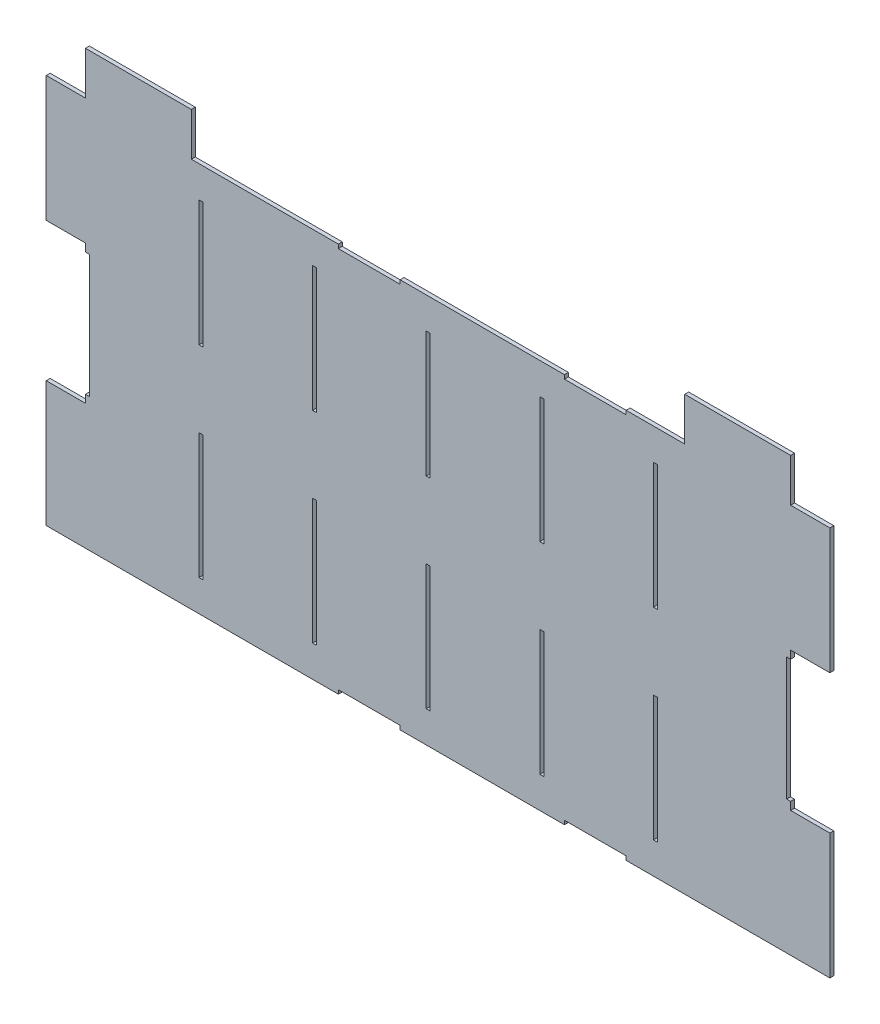
from build123d import *

# Parameters (mm, degrees)
SKETCH1_W                 = 570.860988324
SKETCH1_H                 = 315.575
BOSS_EXTRUDE1_DEPTH       = 3.175
SKETCH2_W                 = 3.175
SKETCH2_H                 = 101.6
CUT_EXTRUDE1_DEPTH        = 3.175
SKETCH7_W                 = 50
SKETCH7_H                 = 3.175
CUT_EXTRUDE5_DEPTH        = 3.175
LPATTERN2_COPY_1_SKETCH_W = 3.175
LPATTERN2_COPY_1_SKETCH_H = 101.6
LPATTERN2_COPY_1_DEPTH    = 3.175
LPATTERN2_COPY_2_SKETCH_W = 3.175
LPATTERN2_COPY_2_SKETCH_H = 101.6
LPATTERN2_COPY_2_DEPTH    = 3.175
LPATTERN2_COPY_3_SKETCH_W = 3.175
LPATTERN2_COPY_3_SKETCH_H = 101.6
LPATTERN2_COPY_3_DEPTH    = 3.175
LPATTERN2_COPY_4_SKETCH_W = 3.175
LPATTERN2_COPY_4_SKETCH_H = 101.6
LPATTERN2_COPY_4_DEPTH    = 3.175
LPATTERN2_COPY_5_SKETCH_W = 3.175
LPATTERN2_COPY_5_SKETCH_H = 101.6
LPATTERN2_COPY_5_DEPTH    = 3.175
LPATTERN2_COPY_6_SKETCH_W = 3.175
LPATTERN2_COPY_6_SKETCH_H = 101.6
LPATTERN2_COPY_6_DEPTH    = 3.175
LPATTERN2_COPY_7_SKETCH_W = 3.175
LPATTERN2_COPY_7_SKETCH_H = 101.6
LPATTERN2_COPY_7_DEPTH    = 3.175
LPATTERN2_COPY_8_SKETCH_W = 3.175
LPATTERN2_COPY_8_SKETCH_H = 101.6
LPATTERN2_COPY_8_DEPTH    = 3.175
SKETCH9_W                 = 85.725
SKETCH9_H                 = 34.925
SKETCH9_W_2               = 31.75
SKETCH9_H_2               = 101.6
BOSS_EXTRUDE3_DEPTH       = 3.175
SKETCH10_W                = 3.175
SKETCH10_H                = 99.675
CUT_EXTRUDE6_DEPTH        = 372.149099633


with BuildPart() as part:
    # Sketch1 → Boss-Extrude1 (new body)
    with BuildSketch(Plane.XY):
        Rectangle(SKETCH1_W, SKETCH1_H)
    extrude(amount=BOSS_EXTRUDE1_DEPTH)

    # Sketch2 → Cut-Extrude1 (cut)
    with BuildSketch(Plane.XY.offset(3.175)):
        with Locations((-191.887994162, -81.5875)):
            Rectangle(SKETCH2_W, SKETCH2_H)
    cut_extrude1 = extrude(amount=-CUT_EXTRUDE1_DEPTH, mode=Mode.SUBTRACT)

    # Sketch7 → Cut-Extrude5 (cut)
    with BuildSketch(Plane.XY.offset(3.175)):
        with Locations((127.304934912, -156.2)):
            Rectangle(SKETCH7_W, SKETCH7_H)
        with Locations((-55.695065088, -156.2)):
            Rectangle(SKETCH7_W, SKETCH7_H)
    cut_extrude5 = extrude(amount=-CUT_EXTRUDE5_DEPTH, mode=Mode.SUBTRACT)

    # Mirror3: Cut-Extrude1 across plane
    add(cut_extrude1.mirror(Plane.ZX), mode=Mode.SUBTRACT)

    # LPattern2 copy 1 sketch → LPattern2 copy 1 (cut)
    with BuildSketch(Plane(origin=(91.96, 0, 3.175), x_dir=(1, 0, 0), z_dir=(0, 0, 1))):
        with Locations((-191.887994162, 81.5875)):
            Rectangle(LPATTERN2_COPY_1_SKETCH_W, LPATTERN2_COPY_1_SKETCH_H)
    extrude(amount=-LPATTERN2_COPY_1_DEPTH, mode=Mode.SUBTRACT)

    # LPattern2 copy 2 sketch → LPattern2 copy 2 (cut)
    with BuildSketch(Plane(origin=(183.92, 0, 3.175), x_dir=(1, 0, 0), z_dir=(0, 0, 1))):
        with Locations((-191.887994162, 81.5875)):
            Rectangle(LPATTERN2_COPY_2_SKETCH_W, LPATTERN2_COPY_2_SKETCH_H)
    extrude(amount=-LPATTERN2_COPY_2_DEPTH, mode=Mode.SUBTRACT)

    # LPattern2 copy 3 sketch → LPattern2 copy 3 (cut)
    with BuildSketch(Plane(origin=(275.88, 0, 3.175), x_dir=(1, 0, 0), z_dir=(0, 0, 1))):
        with Locations((-191.887994162, 81.5875)):
            Rectangle(LPATTERN2_COPY_3_SKETCH_W, LPATTERN2_COPY_3_SKETCH_H)
    extrude(amount=-LPATTERN2_COPY_3_DEPTH, mode=Mode.SUBTRACT)

    # LPattern2 copy 4 sketch → LPattern2 copy 4 (cut)
    with BuildSketch(Plane(origin=(367.84, 0, 3.175), x_dir=(1, 0, 0), z_dir=(0, 0, 1))):
        with Locations((-191.887994162, 81.5875)):
            Rectangle(LPATTERN2_COPY_4_SKETCH_W, LPATTERN2_COPY_4_SKETCH_H)
    extrude(amount=-LPATTERN2_COPY_4_DEPTH, mode=Mode.SUBTRACT)

    # LPattern2 copy 5 sketch → LPattern2 copy 5 (cut)
    with BuildSketch(Plane(origin=(91.96, 0, 3.175), x_dir=(1, 0, 0), z_dir=(0, 0, 1))):
        with Locations((-191.887994162, -81.5875)):
            Rectangle(LPATTERN2_COPY_5_SKETCH_W, LPATTERN2_COPY_5_SKETCH_H)
    extrude(amount=-LPATTERN2_COPY_5_DEPTH, mode=Mode.SUBTRACT)

    # LPattern2 copy 6 sketch → LPattern2 copy 6 (cut)
    with BuildSketch(Plane(origin=(183.92, 0, 3.175), x_dir=(1, 0, 0), z_dir=(0, 0, 1))):
        with Locations((-191.887994162, -81.5875)):
            Rectangle(LPATTERN2_COPY_6_SKETCH_W, LPATTERN2_COPY_6_SKETCH_H)
    extrude(amount=-LPATTERN2_COPY_6_DEPTH, mode=Mode.SUBTRACT)

    # LPattern2 copy 7 sketch → LPattern2 copy 7 (cut)
    with BuildSketch(Plane(origin=(275.88, 0, 3.175), x_dir=(1, 0, 0), z_dir=(0, 0, 1))):
        with Locations((-191.887994162, -81.5875)):
            Rectangle(LPATTERN2_COPY_7_SKETCH_W, LPATTERN2_COPY_7_SKETCH_H)
    extrude(amount=-LPATTERN2_COPY_7_DEPTH, mode=Mode.SUBTRACT)

    # LPattern2 copy 8 sketch → LPattern2 copy 8 (cut)
    with BuildSketch(Plane(origin=(367.84, 0, 3.175), x_dir=(1, 0, 0), z_dir=(0, 0, 1))):
        with Locations((-191.887994162, -81.5875)):
            Rectangle(LPATTERN2_COPY_8_SKETCH_W, LPATTERN2_COPY_8_SKETCH_H)
    extrude(amount=-LPATTERN2_COPY_8_DEPTH, mode=Mode.SUBTRACT)

    # Sketch9 → Boss-Extrude3 (add)
    with BuildSketch(Plane(origin=(0, 0, 0), x_dir=(-1, 0, 0), z_dir=(0, 0, -1))):
        with Locations((-242.567994162, 175.25)):
            Rectangle(SKETCH9_W, SKETCH9_H)
        Polygon((-285.430494162, 56.1875), (-285.430494162, 157.7875), (-301.305494162, 157.7875), (-317.180494162, 157.7875), (-317.180494162, 56.1875), align=None)
        with Locations((-301.305494162, -106.9875)):
            Rectangle(SKETCH9_W_2, SKETCH9_H_2)
    boss_extrude3 = extrude(amount=-BOSS_EXTRUDE3_DEPTH)

    # Mirror4: Boss-Extrude3 across plane
    add(boss_extrude3.mirror(Plane(origin=(0, 0, 0), x_dir=(0, 0, 1), z_dir=(1, 0, 0))))

    # Mirror5: Cut-Extrude5 across plane
    add(cut_extrude5.mirror(Plane.ZX), mode=Mode.SUBTRACT)

    # Sketch10 → Cut-Extrude6 (cut, through all)
    with BuildSketch(Plane(origin=(0, 0, 0), x_dir=(-1, 0, 0), z_dir=(0, 0, -1))):
        with Locations((-283.842994162, 0)):
            Rectangle(SKETCH10_W, SKETCH10_H)
    cut_extrude6 = extrude(amount=-CUT_EXTRUDE6_DEPTH, mode=Mode.SUBTRACT)

    # Mirror6: Cut-Extrude6 across plane
    add(cut_extrude6.mirror(Plane(origin=(0, 0, 0), x_dir=(0, 0, 1), z_dir=(1, 0, 0))), mode=Mode.SUBTRACT)


solid = part.part
